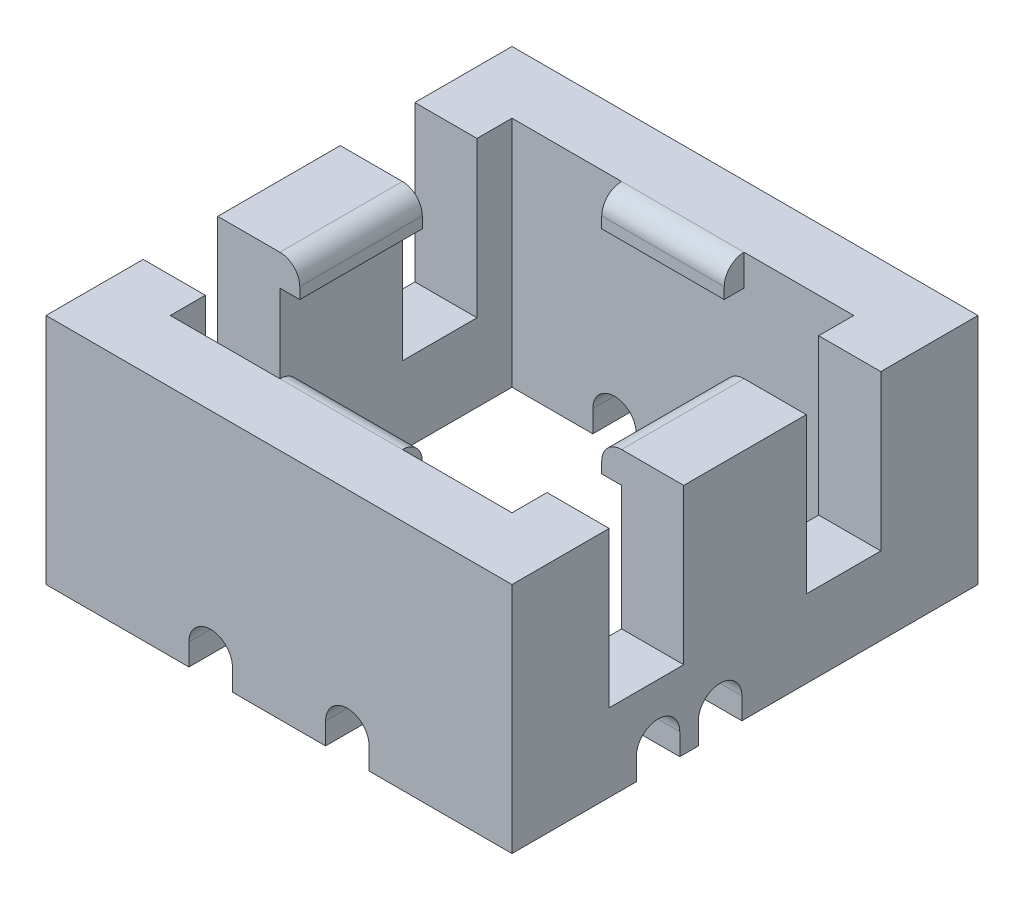
from build123d import *

# Parameters (mm, degrees)
BOSS_EXTRUDE1_DEPTH   = 1.27
SKETCH1_W             = 3.3528
SKETCH1_H             = 2.50444
BOSS_EXTRUDE1_2_DEPTH = 1.27
FILLET3_R             = 0.8128
FILLET4_R             = 0.8128
SKETCH5_W             = 2.54
SKETCH5_H             = 5.00888
BOSS_EXTRUDE3_DEPTH   = 5.08
SKETCH6_W             = 19.05
SKETCH6_H             = 19.05
SKETCH6_W_2           = 13.97
SKETCH6_H_2           = 13.97
BOSS_EXTRUDE4_DEPTH   = 3.175
SKETCH7_W             = 2.54
SKETCH7_H             = 1.778
SKETCH7_W_2           = 1.778
SKETCH7_H_2           = 2.54
CUT_EXTRUDE2_DEPTH    = 1.778
FILLET6_R             = 0.889


with BuildPart() as part:
    # Sketch1 → Boss-Extrude1 (new body)
    with BuildSketch(Plane(origin=(0, 0, 0), x_dir=(1, 0, 0), z_dir=(0, 1, 0))):
        Polygon((0.8128, 1.061632718), (0.8128, -0.370927282), (5.29336, -0.370927282), (5.29336, 0.441872718), (7.7978, 0.441872718), (7.7978, -2.910927282), (-1.7272, -2.910927282), (-1.7272, 1.061632718), align=None)
    extrude(amount=BOSS_EXTRUDE1_DEPTH)

    # Fillet3
    fillet3_edges = [part.edges().sort_by_distance(p)[0] for p in [
        (6.54558, 1.27, -0.441872718),
    ]]
    fillet(fillet3_edges, radius=FILLET3_R)


with BuildPart() as body_2:
    # Sketch1 → Boss-Extrude1 2 (new body)
    with BuildSketch(Plane(origin=(0, 0, 0), x_dir=(1, 0, 0), z_dir=(0, 1, 0))):
        with Locations((-0.0508, 5.361852718)):
            Rectangle(SKETCH1_W, SKETCH1_H)
    extrude(amount=BOSS_EXTRUDE1_2_DEPTH)

    # Fillet4
    fillet4_edges = [body_2.edges().sort_by_distance(p)[0] for p in [
        (1.6256, 1.27, -5.361852718),
    ]]
    fillet(fillet4_edges, radius=FILLET4_R)


with BuildPart() as body_3:
    # Mirror6: mirrored copy
    add(part.part.mirror(Plane(origin=(7.7978, 1.27, -0.441872718), x_dir=(0, 0, 1), z_dir=(-1, 0, 0))))


with BuildPart() as body_4:
    # Mirror6 2: mirrored copy
    add(body_2.part.mirror(Plane(origin=(7.7978, 1.27, -0.441872718), x_dir=(0, 0, 1), z_dir=(-1, 0, 0))))


with BuildPart() as body_5:
    # Mirror7: mirrored copy
    add(body_3.part.mirror(Plane(origin=(17.3228, 1.27, -6.614072718), x_dir=(1, 0, 0), z_dir=(0, 0, 1))))


with BuildPart() as body_6:
    # Mirror7 2: mirrored copy
    add(body_4.part.mirror(Plane(origin=(17.3228, 1.27, -6.614072718), x_dir=(1, 0, 0), z_dir=(0, 0, 1))))


with BuildPart() as body_7:
    # Mirror8: mirrored copy
    add(body_5.part.mirror(Plane(origin=(7.7978, 1.27, -12.786272718), x_dir=(0, 0, 1), z_dir=(1, 0, 0))))


with BuildPart() as body_8:
    # Mirror8 2: mirrored copy
    add(body_6.part.mirror(Plane(origin=(7.7978, 1.27, -12.786272718), x_dir=(0, 0, 1), z_dir=(1, 0, 0))))


with BuildPart() as part_1:
    add(part.part)

    add(body_2.part)  # Boss-Extrude3 merges body 2

    add(body_3.part)  # Boss-Extrude3 merges body 3

    add(body_4.part)  # Boss-Extrude3 merges body 4

    add(body_5.part)  # Boss-Extrude3 merges body 5

    add(body_6.part)  # Boss-Extrude3 merges body 6

    add(body_7.part)  # Boss-Extrude3 merges body 7

    add(body_8.part)  # Boss-Extrude3 merges body 8
    # Sketch5 → Boss-Extrude3 (add)
    with BuildSketch(Plane.XZ):
        Polygon((17.3228, -1.061632718), (14.7828, -1.061632718), (14.7828, 0.370927282), (0.8128, 0.370927282), (0.8128, -1.061632718), (-1.7272, -1.061632718), (-1.7272, 2.910927282), (17.3228, 2.910927282), align=None)
        Polygon((17.3228, -16.139072718), (-1.7272, -16.139072718), (-1.7272, -12.166512718), (0.8128, -12.166512718), (0.8128, -13.599072718), (14.7828, -13.599072718), (14.7828, -12.166512718), (17.3228, -12.166512718), align=None)
        with Locations((16.0528, -6.614072718)):
            Rectangle(SKETCH5_W, SKETCH5_H)
        with Locations((-0.4572, -6.614072718)):
            Rectangle(SKETCH5_W, SKETCH5_H)
    extrude(amount=BOSS_EXTRUDE3_DEPTH)

    # Sketch6 → Boss-Extrude4 (add)
    with BuildSketch(Plane.XZ.offset(5.08)):
        with Locations((7.7978, -6.614072718)):
            Rectangle(SKETCH6_W, SKETCH6_H)
        with Locations((7.7978, -6.614072718)):
            Rectangle(SKETCH6_W_2, SKETCH6_H_2, mode=Mode.SUBTRACT)
    extrude(amount=BOSS_EXTRUDE4_DEPTH)

    # Sketch7 → Cut-Extrude2 (cut)
    with BuildSketch(Plane.XZ.offset(8.255)):
        with Locations((-0.4572, -5.598072718)):
            Rectangle(SKETCH7_W, SKETCH7_H)
        with Locations((-0.4572, -3.058072718)):
            Rectangle(SKETCH7_W, SKETCH7_H)
        with Locations((10.5918, 1.640927282)):
            Rectangle(SKETCH7_W_2, SKETCH7_H_2)
        with Locations((5.0038, 1.640927282)):
            Rectangle(SKETCH7_W_2, SKETCH7_H_2)
        with Locations((10.5918, -14.869072718)):
            Rectangle(SKETCH7_W_2, SKETCH7_H_2)
        with Locations((5.0038, -14.869072718)):
            Rectangle(SKETCH7_W_2, SKETCH7_H_2)
        with Locations((16.0528, -5.598072718)):
            Rectangle(SKETCH7_W, SKETCH7_H)
        with Locations((16.0528, -3.058072718)):
            Rectangle(SKETCH7_W, SKETCH7_H)
    extrude(amount=-CUT_EXTRUDE2_DEPTH, mode=Mode.SUBTRACT)

    # Fillet6
    fillet6_edges = [part_1.edges().sort_by_distance(p)[0] for p in [
        (-0.4572, -6.477, -4.709072718),
        (16.0528, -6.477, -4.709072718),
        (11.4808, -6.477, 1.640927282),
        (5.8928, -6.477, 1.640927282),
        (9.7028, -6.477, 1.640927282),
        (4.1148, -6.477, 1.640927282),
        (-0.4572, -6.477, -2.169072718),
        (16.0528, -6.477, -2.169072718),
        (-0.4572, -6.477, -6.487072718),
        (-0.4572, -6.477, -3.947072718),
        (16.0528, -6.477, -3.947072718),
        (16.0528, -6.477, -6.487072718),
        (4.1148, -6.477, -14.869072718),
        (9.7028, -6.477, -14.869072718),
        (5.8928, -6.477, -14.869072718),
        (11.4808, -6.477, -14.869072718),
    ]]
    fillet(fillet6_edges, radius=FILLET6_R - 0.0001)  # a hair under: the kernel refuses the full size


solid = part_1.part
